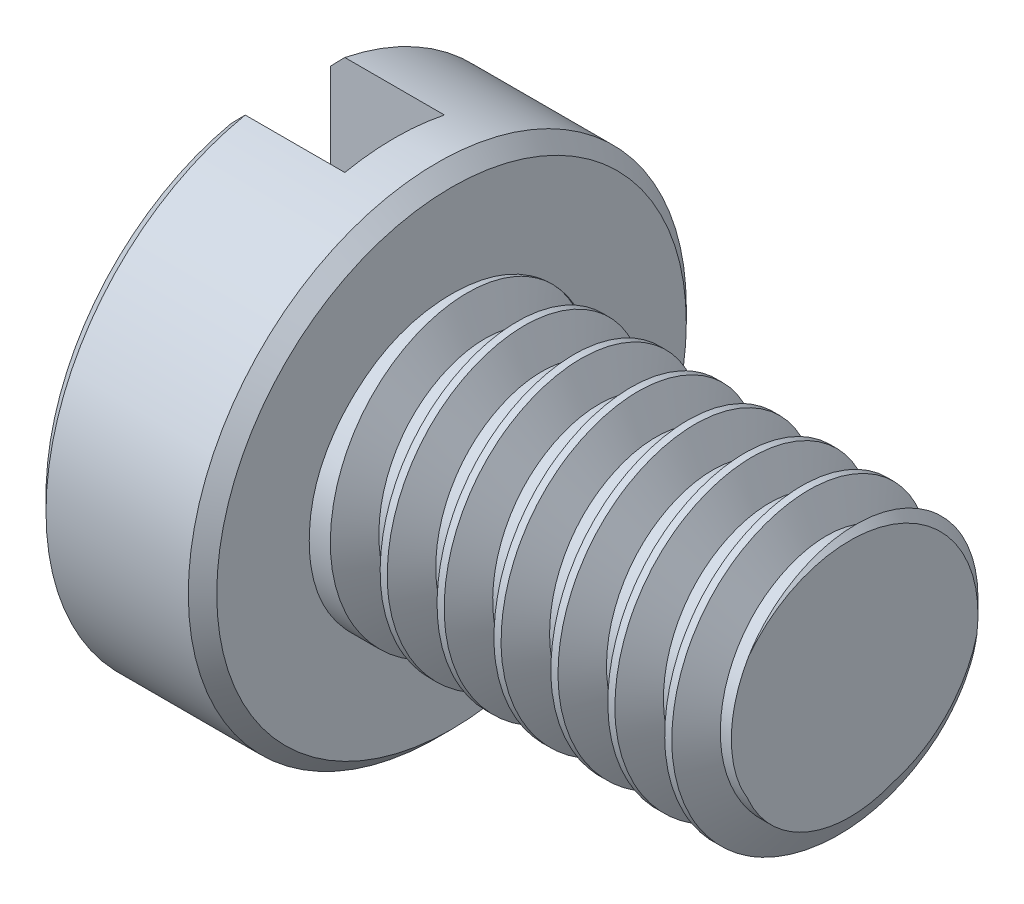
from build123d import *

# Parameters (mm, degrees)
CHAMFER_1_SIZE      = 0.1
SKETCH_2_W          = 0.7
SKETCH_2_H          = 3.5
CUT_EXTRUDE_1_DEPTH = 0.8
THREAD_1_PITCH      = 0.4


with BuildPart() as part:
    # Sketch 1 → Повернуть1 (revolve)
    with BuildSketch(Plane.XY, mode=Mode.PRIVATE) as revolve_1_sk:
        Polygon((0, 0), (0, -1.75), (1.2, -1.75), (1.2, -1), (4, -1), (4, 0), align=None)
    revolve(revolve_1_sk.sketch.rotate(Axis((0, 0, 0), (1, 0, 0)), 270), axis=Axis((0, 0, 0), (1, 0, 0)))

    # Фаска1
    chamfer_1_edges = [part.edges().sort_by_distance(p)[0] for p in [
        (4, 0, -1),
        (1.2, 0, -1.75),
        (0, 0, -1.75),
    ]]
    chamfer(chamfer_1_edges, length=CHAMFER_1_SIZE)

    # Эскиз2 → Вырез-Вытянуть1 (cut)
    with BuildSketch(Plane.ZY):
        Rectangle(SKETCH_2_W, SKETCH_2_H)
    extrude(amount=-CUT_EXTRUDE_1_DEPTH, mode=Mode.SUBTRACT)

    # Резьба1: the profile of Sketch 1 2 profile screwed along a right-hand helix of 8.5 turns, 6 arcs to a turn; built about Z, then put on its axis
    thread_1_z = Axis((0, 0, 0), (0, 0, 1))
    thread_1_corners = [(1.0003, 0, -0.000173205), (1.0003, 0, 0.350173204), (0.78349365, 0, 0.224999999), (0.78349365, 0, 0.124999999)]
    with BuildLine(mode=Mode.PRIVATE) as thread_1_profile:
        Line(thread_1_corners[0], thread_1_corners[1])
        Line(thread_1_corners[1], thread_1_corners[2])
        Line(thread_1_corners[2], thread_1_corners[3])
        Line(thread_1_corners[3], thread_1_corners[0])
    thread_1_cap = Face(thread_1_profile.wire())
    thread_1_turn_angles = [0, 30, 60, 90, 120, 150, 180, 210, 240, 270, 300, 330, 360]
    thread_1_turn_weights = [1, 0.8660254037844387, 1, 0.8660254037844387, 1, 0.8660254037844387, 1, 0.8660254037844387, 1, 0.8660254037844387, 1, 0.8660254037844387, 1]
    thread_1_turn_rails = [Edge.make_bspline([Vector(p[0], p[1], 0).rotate(thread_1_z, thread_1_turn_angles[k]) / thread_1_turn_weights[k] + Vector(0, 0, p[2] + THREAD_1_PITCH * thread_1_turn_angles[k] / 360) for k in range(13)], [0, 0, 0, 1, 1, 2, 2, 3, 3, 4, 4, 5, 5, 6, 6, 6], 2, thread_1_turn_weights) for p in thread_1_corners]
    thread_1_turn_sides = [Face.make_surface_from_curves(thread_1_turn_rails[p[0]], thread_1_turn_rails[p[1]]) for p in [(0, 1), (1, 2), (2, 3), (3, 0)]]
    thread_1_last_angles = [2880, 2910, 2940, 2970, 3000, 3030, 3060]
    thread_1_last_weights = [1, 0.8660254037844387, 1, 0.8660254037844387, 1, 0.8660254037844387, 1]
    thread_1_last_rails = [Edge.make_bspline([Vector(p[0], p[1], 0).rotate(thread_1_z, thread_1_last_angles[k]) / thread_1_last_weights[k] + Vector(0, 0, p[2] + THREAD_1_PITCH * thread_1_last_angles[k] / 360) for k in range(7)], [0, 0, 0, 1, 1, 2, 2, 3, 3, 3], 2, thread_1_last_weights) for p in thread_1_corners]
    thread_1_last_sides = [Face.make_surface_from_curves(thread_1_last_rails[p[0]], thread_1_last_rails[p[1]]) for p in [(0, 1), (1, 2), (2, 3), (3, 0)]]
    thread_1 = Plane(origin=(4.9, 0, 0), x_dir=(0, 0, 1), z_dir=(-1, 0, 0)) * Solid(Shell([*[p.moved(Location((0, 0, THREAD_1_PITCH * i))) for i in range(8) for p in thread_1_turn_sides], *thread_1_last_sides, thread_1_cap, thread_1_cap.rotate(thread_1_z, 3060).moved(Location((0, 0, THREAD_1_PITCH * 3060 / 360)))]))
    add(thread_1, mode=Mode.SUBTRACT)


solid = part.part
